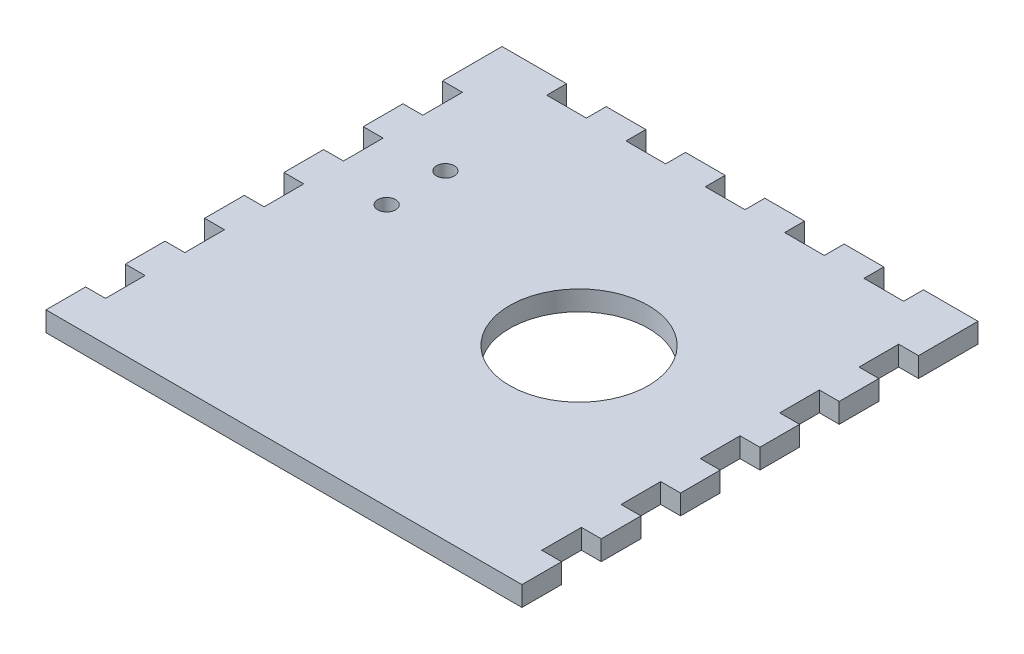
from build123d import *

# Parameters (mm, degrees)
SKETCH1_W               = 279.4
SKETCH1_H               = 279.4
BOSS_EXTRUDE1_DEPTH     = 12.7
SKETCH2_W               = 25.4
SKETCH2_H               = 12.7
BOSS_EXTRUDE2_DEPTH     = 12.7
LPATTERN1_COUNT         = 6
LPATTERN1_PITCH         = 50.8
MIRROR1_COPY_1_SKETCH_W = 25.4
MIRROR1_COPY_1_SKETCH_H = 12.7
MIRROR1_COPY_1_DEPTH    = 12.7
MIRROR1_COPY_2_SKETCH_W = 25.4
MIRROR1_COPY_2_SKETCH_H = 12.7
MIRROR1_COPY_2_DEPTH    = 12.7
MIRROR1_COPY_3_SKETCH_W = 25.4
MIRROR1_COPY_3_SKETCH_H = 12.7
MIRROR1_COPY_3_DEPTH    = 12.7
MIRROR1_COPY_4_SKETCH_W = 25.4
MIRROR1_COPY_4_SKETCH_H = 12.7
MIRROR1_COPY_4_DEPTH    = 12.7
MIRROR1_COPY_5_SKETCH_W = 25.4
MIRROR1_COPY_5_SKETCH_H = 12.7
MIRROR1_COPY_5_DEPTH    = 12.7
MIRROR1_COPY_6_SKETCH_W = 25.4
MIRROR1_COPY_6_SKETCH_H = 12.7
MIRROR1_COPY_6_DEPTH    = 12.7
SKETCH3_W               = 25.4
SKETCH3_H               = 12.7
BOSS_EXTRUDE3_DEPTH     = 12.7
LPATTERN2_COUNT         = 6
LPATTERN2_PITCH         = 50.8
SKETCH5_W               = 17.00363529
SKETCH5_H               = 12.7
BOSS_EXTRUDE4_DEPTH     = 12.7
SKETCH6_R               = 44.45
CUT_EXTRUDE1_DEPTH      = 216.9
SKETCH7_R               = 5.715
CUT_EXTRUDE2_DEPTH      = 216.9


with BuildPart() as part:
    # Sketch1 → Boss-Extrude1 (new body)
    with BuildSketch(Plane(origin=(0, 0, 0), x_dir=(1, 0, 0), z_dir=(0, 1, 0))):
        Rectangle(SKETCH1_W, SKETCH1_H)
    extrude(amount=BOSS_EXTRUDE1_DEPTH)

    # Sketch2 → Boss-Extrude2 (add)
    with BuildSketch(Plane(origin=(139.7, 0, 0), x_dir=(0, 0, -1), z_dir=(1, 0, 0))):
        with Locations((-127, 6.35)):
            Rectangle(SKETCH2_W, SKETCH2_H)
    boss_extrude2 = extrude(amount=BOSS_EXTRUDE2_DEPTH)

    # LPattern1: Boss-Extrude2 ×6
    with Locations(*[(0, 0, -i * LPATTERN1_PITCH) for i in range(1, LPATTERN1_COUNT)]):
        add(boss_extrude2)

    # Mirror1 copy 1 sketch → Mirror1 copy 1 (add)
    with BuildSketch(Plane(origin=(-139.7, 0, -50.8), x_dir=(0, 0, -1), z_dir=(-1, 0, 0))):
        with Locations((-127, -6.35)):
            Rectangle(MIRROR1_COPY_1_SKETCH_W, MIRROR1_COPY_1_SKETCH_H)
    extrude(amount=MIRROR1_COPY_1_DEPTH)

    # Mirror1 copy 2 sketch → Mirror1 copy 2 (add)
    with BuildSketch(Plane(origin=(-139.7, 0, -101.6), x_dir=(0, 0, -1), z_dir=(-1, 0, 0))):
        with Locations((-127, -6.35)):
            Rectangle(MIRROR1_COPY_2_SKETCH_W, MIRROR1_COPY_2_SKETCH_H)
    extrude(amount=MIRROR1_COPY_2_DEPTH)

    # Mirror1 copy 3 sketch → Mirror1 copy 3 (add)
    with BuildSketch(Plane(origin=(-139.7, 0, -152.4), x_dir=(0, 0, -1), z_dir=(-1, 0, 0))):
        with Locations((-127, -6.35)):
            Rectangle(MIRROR1_COPY_3_SKETCH_W, MIRROR1_COPY_3_SKETCH_H)
    extrude(amount=MIRROR1_COPY_3_DEPTH)

    # Mirror1 copy 4 sketch → Mirror1 copy 4 (add)
    with BuildSketch(Plane(origin=(-139.7, 0, -203.2), x_dir=(0, 0, -1), z_dir=(-1, 0, 0))):
        with Locations((-127, -6.35)):
            Rectangle(MIRROR1_COPY_4_SKETCH_W, MIRROR1_COPY_4_SKETCH_H)
    extrude(amount=MIRROR1_COPY_4_DEPTH)

    # Mirror1 copy 5 sketch → Mirror1 copy 5 (add)
    with BuildSketch(Plane(origin=(-139.7, 0, -254), x_dir=(0, 0, -1), z_dir=(-1, 0, 0))):
        with Locations((-127, -6.35)):
            Rectangle(MIRROR1_COPY_5_SKETCH_W, MIRROR1_COPY_5_SKETCH_H)
    extrude(amount=MIRROR1_COPY_5_DEPTH)

    # Mirror1 copy 6 sketch → Mirror1 copy 6 (add)
    with BuildSketch(Plane(origin=(-139.7, 0, 0), x_dir=(0, 0, -1), z_dir=(-1, 0, 0))):
        with Locations((-127, -6.35)):
            Rectangle(MIRROR1_COPY_6_SKETCH_W, MIRROR1_COPY_6_SKETCH_H)
    extrude(amount=MIRROR1_COPY_6_DEPTH)

    # Sketch3 → Boss-Extrude3 (add)
    with BuildSketch(Plane(origin=(0, 0, -139.7), x_dir=(-1, 0, 0), z_dir=(0, 0, -1))):
        with Locations((-130.175, 6.35)):
            Rectangle(SKETCH3_W, SKETCH3_H)
    boss_extrude3 = extrude(amount=BOSS_EXTRUDE3_DEPTH)

    # LPattern2: Boss-Extrude3 ×6
    with Locations(*[(-i * LPATTERN2_PITCH, 0, 0) for i in range(1, LPATTERN2_COUNT)]):
        add(boss_extrude3)

    # Sketch5 → Boss-Extrude4 (add)
    with BuildSketch(Plane(origin=(0, 0, -139.7), x_dir=(-1, 0, 0), z_dir=(0, 0, -1))):
        with Locations((-143.898182355, 6.35)):
            Rectangle(SKETCH5_W, SKETCH5_H)
    boss_extrude4 = extrude(amount=BOSS_EXTRUDE4_DEPTH)

    # Mirror2: Boss-Extrude4 across plane
    add(boss_extrude4.mirror(Plane(origin=(0, 0, 0), x_dir=(0, 0, 1), z_dir=(1, 0, 0))))

    # Sketch6 → Cut-Extrude1 (cut, through all)
    with BuildSketch(Plane(origin=(0, 12.7, 0), x_dir=(1, 0, 0), z_dir=(0, 1, 0))):
        with Locations((38.1, 11.176)):
            Circle(SKETCH6_R)
    extrude(amount=-CUT_EXTRUDE1_DEPTH, mode=Mode.SUBTRACT)

    # Sketch7 → Cut-Extrude2 (cut, through all)
    with BuildSketch(Plane(origin=(0, 12.7, 0), x_dir=(1, 0, 0), z_dir=(0, 1, 0))):
        with Locations((-101.6, 65.278)):
            Circle(SKETCH7_R)
        with Locations((-101.6, 27.686)):
            Circle(SKETCH7_R)
    extrude(amount=-CUT_EXTRUDE2_DEPTH, mode=Mode.SUBTRACT)


solid = part.part
